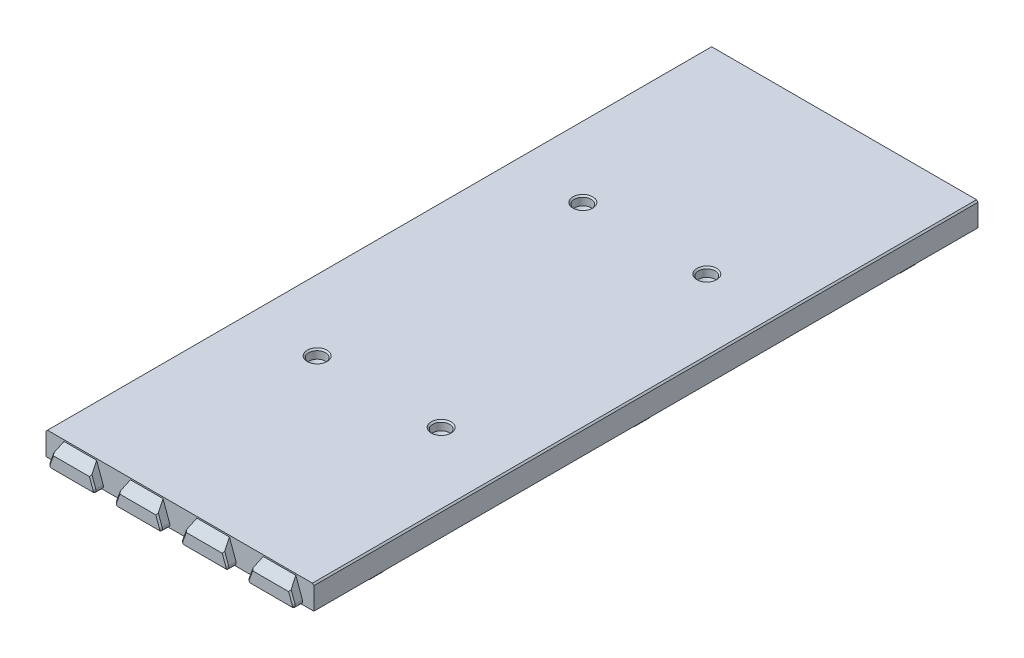
from build123d import *

# Parameters (mm, degrees)
BOSS_EXTRUDE1_DEPTH             = 112.5
SKETCH7_W                       = 86.75
SKETCH7_H                       = 6
BOSS_EXTRUDE7_DEPTH             = 1
BOSS_EXTRUDE4_DEPTH             = 3
BOSS_EXTRUDE8_REACH             = 123.569
BOSS_EXTRUDE8_DIRECTION_2_DEPTH = 2
CHAMFER4_SIZE                   = 0.5
FILLET4_R                       = 1
CHAMFER6_SIZE                   = 0.5
FILLET2_R                       = 2
CHAMFER4_OF_MIRROR2_SIZE        = 0.5
FILLET4_OF_MIRROR2_R            = 1
CHAMFER6_OF_MIRROR2_SIZE        = 0.5
FILLET2_OF_MIRROR2_R            = 2
BOSS_EXTRUDE9_REACH             = 234.609
SKETCH9_R                       = 5
FILLET3_R                       = 3
SKETCH10_R                      = 1.85
CUT_EXTRUDE2_DEPTH              = 233.608879076
SKETCH11_R                      = 2.85
CUT_EXTRUDE3_DEPTH              = 3
CHAMFER7_SIZE                   = 1
CUT_EXTRUDE4_DEPTH              = 233.608879076
CUT_EXTRUDE4_DEPTH_BACK         = 233.608879076
CHAMFER8_SIZE                   = 0.5


with BuildPart() as part:
    # Sketch1 → Boss-Extrude1 (new body)
    with BuildSketch(Plane.XY):
        Polygon((-45.375, 0), (-45.375, 8), (45.375, 8), (45.375, 0), (43.375, 0), (43.375, 6), (-43.375, 6), (-43.375, 0), align=None)
    boss_extrude1 = extrude(amount=-BOSS_EXTRUDE1_DEPTH)

    # Sketch7 → Boss-Extrude7 (add)
    with BuildSketch(Plane.XY):
        with Locations((0, 3)):
            Rectangle(SKETCH7_W, SKETCH7_H)
    boss_extrude7 = extrude(amount=-BOSS_EXTRUDE7_DEPTH)

    # Sketch2 → Boss-Extrude4 (add)
    with BuildSketch(Plane.XY):
        Polygon((28.411761874, 8), (25.5, 0), (42, 0), (39.088238126, 8), align=None)
        Polygon((5.911761874, 8), (3, 0), (19.5, 0), (16.588238126, 8), align=None)
        Polygon((-16.588238126, 8), (-19.5, 0), (-3, 0), (-5.911761874, 8), align=None)
        Polygon((-39.088238126, 8), (-42, 0), (-25.5, 0), (-28.411761874, 8), align=None)
    boss_extrude4 = extrude(amount=BOSS_EXTRUDE4_DEPTH)

    # Sketch8 → Boss-Extrude8 (add, up to next)
    with BuildSketch(Plane.XZ, mode=Mode.PRIVATE) as boss_extrude8_sk1:
        Polygon((-44, -24.955880937), (-44, -20.044119063), (-40, -21.5), (-40, -23.5), align=None)
    boss_extrude8_tool1 = extrude(boss_extrude8_sk1.sketch, amount=-BOSS_EXTRUDE8_REACH, mode=Mode.PRIVATE) - part.part
    # Sketch8 → Boss-Extrude8 (add, up to next)
    with BuildSketch(Plane.XZ, mode=Mode.PRIVATE) as boss_extrude8_sk2:
        Polygon((-44, -112.5), (-44, -110.044119063), (-40, -111.5), (-40, -112.5), align=None)
    boss_extrude8_tool2 = extrude(boss_extrude8_sk2.sketch, amount=-BOSS_EXTRUDE8_REACH, mode=Mode.PRIVATE) - part.part
    # Sketch8 → Boss-Extrude8 (add, up to next)
    with BuildSketch(Plane.XZ, mode=Mode.PRIVATE) as boss_extrude8_sk3:
        Polygon((44, -24.955880937), (40, -23.5), (40, -21.5), (44, -20.044119063), align=None)
    boss_extrude8_tool3 = extrude(boss_extrude8_sk3.sketch, amount=-BOSS_EXTRUDE8_REACH, mode=Mode.PRIVATE) - part.part
    # Sketch8 → Boss-Extrude8 (add, up to next)
    with BuildSketch(Plane.XZ, mode=Mode.PRIVATE) as boss_extrude8_sk4:
        Polygon((40, -112.5), (44, -112.5), (44, -110.044119063), (40, -111.5), align=None)
    boss_extrude8_tool4 = extrude(boss_extrude8_sk4.sketch, amount=-BOSS_EXTRUDE8_REACH, mode=Mode.PRIVATE) - part.part
    boss_extrude8_1 = boss_extrude8_tool1.solids().sort_by_distance((-42.280851, 0, -22.5))[0]
    add(boss_extrude8_1)
    boss_extrude8_2 = boss_extrude8_tool2.solids().sort_by_distance((-42.280851, 0, -111.584919))[0]
    add(boss_extrude8_2)
    boss_extrude8_3 = boss_extrude8_tool3.solids().sort_by_distance((42.280851, 0, -22.5))[0]
    add(boss_extrude8_3)
    boss_extrude8_4 = boss_extrude8_tool4.solids().sort_by_distance((42.280851, 0, -111.584919))[0]
    add(boss_extrude8_4)
    boss_extrude8 = boss_extrude8_1 + boss_extrude8_2 + boss_extrude8_3 + boss_extrude8_4  # Boss-Extrude8 as one shape, for the pattern or mirror that repeats it

    # Sketch8 → Boss-Extrude8 direction 2 (add)
    with BuildSketch(Plane.XZ):
        Polygon((-44, -24.955880937), (-44, -20.044119063), (-40, -21.5), (-40, -23.5), align=None)
        Polygon((-44, -112.5), (-44, -110.044119063), (-40, -111.5), (-40, -112.5), align=None)
        Polygon((44, -24.955880937), (40, -23.5), (40, -21.5), (44, -20.044119063), align=None)
        Polygon((40, -112.5), (44, -112.5), (44, -110.044119063), (40, -111.5), align=None)
    boss_extrude8_direction_2 = extrude(amount=BOSS_EXTRUDE8_DIRECTION_2_DEPTH)

    # Chamfer4
    chamfer4_edges = [part.edges().sort_by_distance(p)[0] for p in [
        (-40, -2, -112),
        (-42, -2, -110.772059531),
        (-44, -2, -111.272059531),
        (-42, -2, -20.772059531),
        (-44, -2, -22.5),
        (-42, -2, -24.227940469),
        (-40, -2, -22.5),
        (44, -2, -22.5),
        (42, -2, -20.772059531),
        (40, -2, -22.5),
        (42, -2, -24.227940469),
        (40, -2, -112),
        (44, -2, -111.272059531),
        (42, -2, -110.772059531),
    ]]
    chamfer(chamfer4_edges, length=CHAMFER4_SIZE)

    # Fillet4
    fillet4_edges = [part.edges().sort_by_distance(p)[0] for p in [
        (25.5, 0, 1.5),
        (42, 0, 1.5),
        (3, 0, 1.5),
        (19.5, 0, 1.5),
        (-19.5, 0, 1.5),
        (-3, 0, 1.5),
        (-42, 0, 1.5),
        (-25.5, 0, 1.5),
    ]]
    fillet(fillet4_edges, radius=FILLET4_R)

    # Chamfer6
    chamfer6_edges = [part.edges().sort_by_distance(p)[0] for p in [
        (33.75, 0, 3),
        (11.25, 0, 3),
        (-11.25, 0, 3),
        (-33.75, 0, 3),
        (-27.20010863, 4.671010072, 3),
        (-26.108995962, 0.426423564, 3),
        (-41.391004038, 0.426423564, 3),
        (-4.70010863, 4.671010072, 3),
        (-3.608995962, 0.426423564, 3),
        (-18.891004038, 0.426423564, 3),
        (17.79989137, 4.671010072, 3),
        (18.891004038, 0.426423564, 3),
        (3.608995962, 0.426423564, 3),
        (40.29989137, 4.671010072, 3),
        (41.391004038, 0.426423564, 3),
        (26.108995962, 0.426423564, 3),
        (27.20010863, 4.671010072, 3),
        (4.70010863, 4.671010072, 3),
        (-17.79989137, 4.671010072, 3),
        (-40.29989137, 4.671010072, 3),
    ]]
    chamfer(chamfer6_edges, length=CHAMFER6_SIZE)

    # Fillet2
    fillet2_edges = [part.edges().sort_by_distance(p)[0] for p in [
        (-43.375, 6, -67.5),
        (-43.375, 3, -110.271600459),
        (-40, 6, -112),
        (-41.6875, 6, -110.88580023),
        (-43.375, 6, -10.63580023),
        (-43.375, 3, -20.271600459),
        (-43.375, 3, -24.728399541),
        (-41.6875, 6, -20.88580023),
        (-40, 6, -22.5),
        (-41.6875, 6, -24.11419977),
        (43.375, 6, -10.63580023),
        (43.375, 3, -20.271600459),
        (43.375, 3, -24.728399541),
        (41.6875, 6, -20.88580023),
        (41.6875, 6, -24.11419977),
        (40, 6, -22.5),
        (43.375, 6, -67.5),
        (43.375, 3, -110.271600459),
        (40, 6, -112),
        (41.6875, 6, -110.88580023),
        (-43.375, 3, -1),
        (0, 6, -1),
        (43.375, 3, -1),
    ]]
    fillet(fillet2_edges, radius=FILLET2_R)


with BuildPart() as mirror2_1:
    # Mirror2: Boss-Extrude1, Boss-Extrude7, Boss-Extrude4, Boss-Extrude8, Boss-Extrude8 direction 2 across plane
    add(boss_extrude1.mirror(Plane.XY.offset(-112.5)))
    add(boss_extrude7.mirror(Plane.XY.offset(-112.5)))
    add(boss_extrude4.mirror(Plane.XY.offset(-112.5)))
    add(boss_extrude8.mirror(Plane.XY.offset(-112.5)))
    add(boss_extrude8_direction_2.mirror(Plane.XY.offset(-112.5)))

    # Chamfer4 of Mirror2
    chamfer4_of_mirror2_edges = [mirror2_1.edges().sort_by_distance(p)[0] for p in [
        (-40, -2, -113),
        (-42, -2, -114.227940469),
        (-44, -2, -113.727940469),
        (-42, -2, -204.227940469),
        (-44, -2, -202.5),
        (-42, -2, -200.772059531),
        (-40, -2, -202.5),
        (44, -2, -202.5),
        (42, -2, -204.227940469),
        (40, -2, -202.5),
        (42, -2, -200.772059531),
        (40, -2, -113),
        (44, -2, -113.727940469),
        (42, -2, -114.227940469),
    ]]
    chamfer(chamfer4_of_mirror2_edges, length=CHAMFER4_OF_MIRROR2_SIZE)

    # Fillet4 of Mirror2
    fillet4_of_mirror2_edges = [mirror2_1.edges().sort_by_distance(p)[0] for p in [
        (25.5, 0, -226.5),
        (42, 0, -226.5),
        (3, 0, -226.5),
        (19.5, 0, -226.5),
        (-19.5, 0, -226.5),
        (-3, 0, -226.5),
        (-42, 0, -226.5),
        (-25.5, 0, -226.5),
    ]]
    fillet(fillet4_of_mirror2_edges, radius=FILLET4_OF_MIRROR2_R)

    # Chamfer6 of Mirror2
    chamfer6_of_mirror2_edges = [mirror2_1.edges().sort_by_distance(p)[0] for p in [
        (33.75, 0, -228),
        (11.25, 0, -228),
        (-11.25, 0, -228),
        (-33.75, 0, -228),
        (-27.20010863, 4.671010072, -228),
        (-26.108995962, 0.426423564, -228),
        (-41.391004038, 0.426423564, -228),
        (-4.70010863, 4.671010072, -228),
        (-3.608995962, 0.426423564, -228),
        (-18.891004038, 0.426423564, -228),
        (17.79989137, 4.671010072, -228),
        (18.891004038, 0.426423564, -228),
        (3.608995962, 0.426423564, -228),
        (40.29989137, 4.671010072, -228),
        (41.391004038, 0.426423564, -228),
        (26.108995962, 0.426423564, -228),
        (27.20010863, 4.671010072, -228),
        (4.70010863, 4.671010072, -228),
        (-17.79989137, 4.671010072, -228),
        (-40.29989137, 4.671010072, -228),
    ]]
    chamfer(chamfer6_of_mirror2_edges, length=CHAMFER6_OF_MIRROR2_SIZE)

    # Fillet2 of Mirror2
    fillet2_of_mirror2_edges = [mirror2_1.edges().sort_by_distance(p)[0] for p in [
        (-43.375, 6, -157.5),
        (-43.375, 3, -114.728399541),
        (-40, 6, -113),
        (-41.6875, 6, -114.11419977),
        (-43.375, 6, -214.36419977),
        (-43.375, 3, -204.728399541),
        (-43.375, 3, -200.271600459),
        (-41.6875, 6, -204.11419977),
        (-40, 6, -202.5),
        (-41.6875, 6, -200.88580023),
        (43.375, 6, -214.36419977),
        (43.375, 3, -204.728399541),
        (43.375, 3, -200.271600459),
        (41.6875, 6, -204.11419977),
        (41.6875, 6, -200.88580023),
        (40, 6, -202.5),
        (43.375, 6, -157.5),
        (43.375, 3, -114.728399541),
        (40, 6, -113),
        (41.6875, 6, -114.11419977),
        (-43.375, 3, -224),
        (0, 6, -224),
        (43.375, 3, -224),
    ]]
    fillet(fillet2_of_mirror2_edges, radius=FILLET2_OF_MIRROR2_R)


with BuildPart() as part_1:
    add(part.part)

    # Mirror2 united with what the copies touc: union Mirror2_1
    add(mirror2_1.part)

    # Sketch9 → Boss-Extrude9 (add, up to next)
    with BuildSketch(Plane(origin=(0, 0, 0), x_dir=(1, 0, 0), z_dir=(0, 1, 0)), mode=Mode.PRIVATE) as boss_extrude9_sk1:
        with Locations(Location((-21, 67.5, 0), (0, 0, 90))):
            Circle(SKETCH9_R)
    boss_extrude9_tool1 = extrude(boss_extrude9_sk1.sketch, amount=BOSS_EXTRUDE9_REACH, mode=Mode.PRIVATE) - part_1.part
    # Sketch9 → Boss-Extrude9 (add, up to next)
    with BuildSketch(Plane(origin=(0, 0, 0), x_dir=(1, 0, 0), z_dir=(0, 1, 0)), mode=Mode.PRIVATE) as boss_extrude9_sk2:
        with Locations(Location((21, 67.5, 0), (0, 0, 90))):
            Circle(SKETCH9_R)
    boss_extrude9_tool2 = extrude(boss_extrude9_sk2.sketch, amount=BOSS_EXTRUDE9_REACH, mode=Mode.PRIVATE) - part_1.part
    # Sketch9 → Boss-Extrude9 (add, up to next)
    with BuildSketch(Plane(origin=(0, 0, 0), x_dir=(1, 0, 0), z_dir=(0, 1, 0)), mode=Mode.PRIVATE) as boss_extrude9_sk3:
        with Locations(Location((21, 157.5, 0), (0, 0, 90))):
            Circle(SKETCH9_R)
    boss_extrude9_tool3 = extrude(boss_extrude9_sk3.sketch, amount=BOSS_EXTRUDE9_REACH, mode=Mode.PRIVATE) - part_1.part
    # Sketch9 → Boss-Extrude9 (add, up to next)
    with BuildSketch(Plane(origin=(0, 0, 0), x_dir=(1, 0, 0), z_dir=(0, 1, 0)), mode=Mode.PRIVATE) as boss_extrude9_sk4:
        with Locations(Location((-21, 157.5, 0), (0, 0, 90))):
            Circle(SKETCH9_R)
    boss_extrude9_tool4 = extrude(boss_extrude9_sk4.sketch, amount=BOSS_EXTRUDE9_REACH, mode=Mode.PRIVATE) - part_1.part
    add(boss_extrude9_tool1.solids().sort_by_distance((-21, 0, -67.5))[0])
    add(boss_extrude9_tool2.solids().sort_by_distance((21, 0, -67.5))[0])
    add(boss_extrude9_tool3.solids().sort_by_distance((21, 0, -157.5))[0])
    add(boss_extrude9_tool4.solids().sort_by_distance((-21, 0, -157.5))[0])

    # Fillet3
    fillet3_edges = [part_1.edges().sort_by_distance(p)[0] for p in [
        (-21, 6, -62.5),
        (-21, 6, -152.5),
        (21, 6, -152.5),
        (21, 6, -62.5),
    ]]
    fillet(fillet3_edges, radius=FILLET3_R)

    # Sketch10 → Cut-Extrude2 (cut, through all)
    with BuildSketch(Plane(origin=(0, 0, 0), x_dir=(1, 0, 0), z_dir=(0, 1, 0))):
        with Locations(Location((-21, 157.5, 0), (0, 0, 270))):
            Circle(SKETCH10_R)
        with Locations(Location((-21, 67.5, 0), (0, 0, 270))):
            Circle(SKETCH10_R)
        with Locations(Location((21, 67.5, 0), (0, 0, 270))):
            Circle(SKETCH10_R)
        with Locations(Location((21, 157.5, 0), (0, 0, 270))):
            Circle(SKETCH10_R)
    extrude(amount=CUT_EXTRUDE2_DEPTH, mode=Mode.SUBTRACT)

    # Sketch11 → Cut-Extrude3 (cut)
    with BuildSketch(Plane(origin=(0, 8, 0), x_dir=(1, 0, 0), z_dir=(0, 1, 0))):
        with Locations(Location((-21, 157.5, 0), (0, 0, 270))):
            Circle(SKETCH11_R)
        with Locations(Location((21, 157.5, 0), (0, 0, 270))):
            Circle(SKETCH11_R)
        with Locations(Location((21, 67.5, 0), (0, 0, 270))):
            Circle(SKETCH11_R)
        with Locations(Location((-21, 67.5, 0), (0, 0, 270))):
            Circle(SKETCH11_R)
    extrude(amount=-CUT_EXTRUDE3_DEPTH, mode=Mode.SUBTRACT)

    # Chamfer7
    chamfer7_edges = [part_1.edges().sort_by_distance(p)[0] for p in [
        (-21, 5, -69.35),
        (21, 5, -69.35),
        (21, 5, -159.35),
        (-21, 5, -159.35),
    ]]
    chamfer(chamfer7_edges, length=CHAMFER7_SIZE - 0.0001)  # a hair under: the kernel refuses the full size

    # Sketch12 → Cut-Extrude4 (cut, two sides: drawn at the far end of the back side and taken through both)
    with BuildSketch(Plane(origin=(0, 0, 0), x_dir=(0, 0, -1), z_dir=(1, 0, 0)).offset(-CUT_EXTRUDE4_DEPTH_BACK)):
        Polygon((0, 7.5), (-3, 4.5), (-3, 7.5), (-3, 8), (0, 8), align=None)
        Polygon((225, 8), (225, 7.5), (228, 4.5), (228, 7.5), (228, 8), align=None)
    extrude(amount=CUT_EXTRUDE4_DEPTH + CUT_EXTRUDE4_DEPTH_BACK, mode=Mode.SUBTRACT)

    # Chamfer8
    chamfer8_edges = [part_1.edges().sort_by_distance(p)[0] for p in [
        (-45.375, 8, -112.5),
        (45.375, 8, -112.5),
        (-21, 8, -70.35),
        (21, 8, -70.35),
        (21, 8, -160.35),
        (-21, 8, -160.35),
    ]]
    chamfer(chamfer8_edges, length=CHAMFER8_SIZE)


solid = part_1.part
